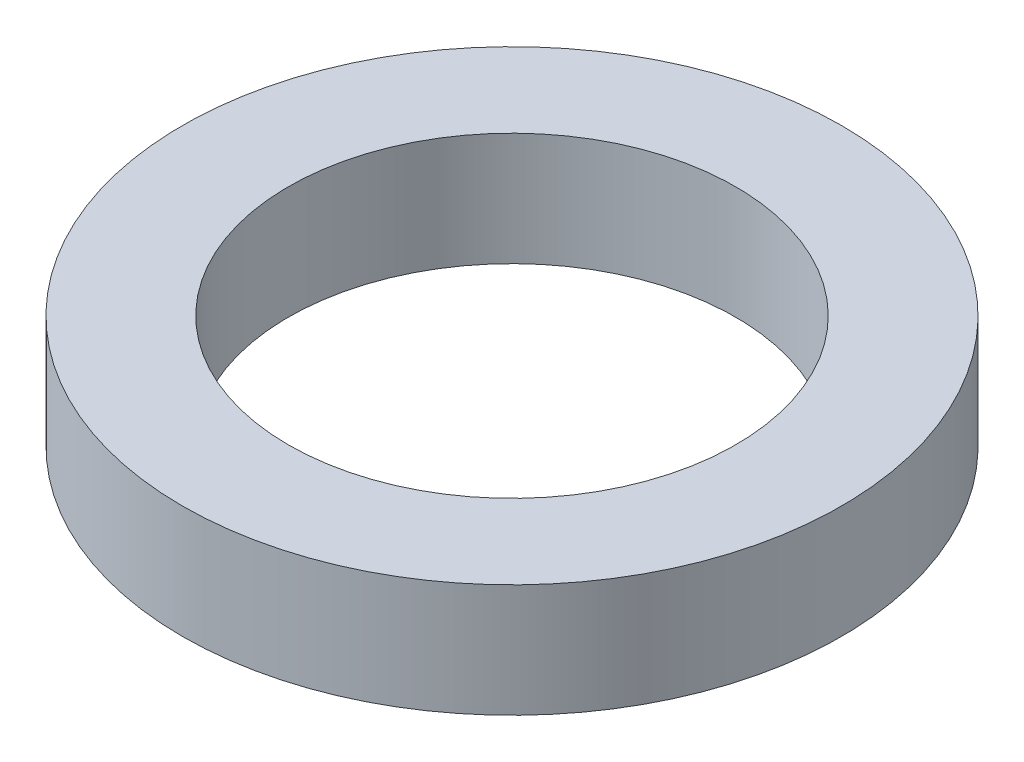
from build123d import *

# Parameters (mm, degrees)
SKETCH1_R           = 70
BOSS_EXTRUDE1_DEPTH = 24
SKETCH2_R           = 47.5
CUT_EXTRUDE1_DEPTH  = 102.862652626


with BuildPart() as part:
    # Sketch1 → Boss-Extrude1 (new body)
    with BuildSketch(Plane(origin=(0, 0, 0), x_dir=(1, 0, 0), z_dir=(0, 1, 0))):
        Circle(SKETCH1_R)
    extrude(amount=BOSS_EXTRUDE1_DEPTH)

    # Sketch2 → Cut-Extrude1 (cut, through all)
    with BuildSketch(Plane(origin=(0, 0, 0), x_dir=(1, 0, 0), z_dir=(0, 1, 0))):
        Circle(SKETCH2_R)
    extrude(amount=CUT_EXTRUDE1_DEPTH, mode=Mode.SUBTRACT)


solid = part.part
